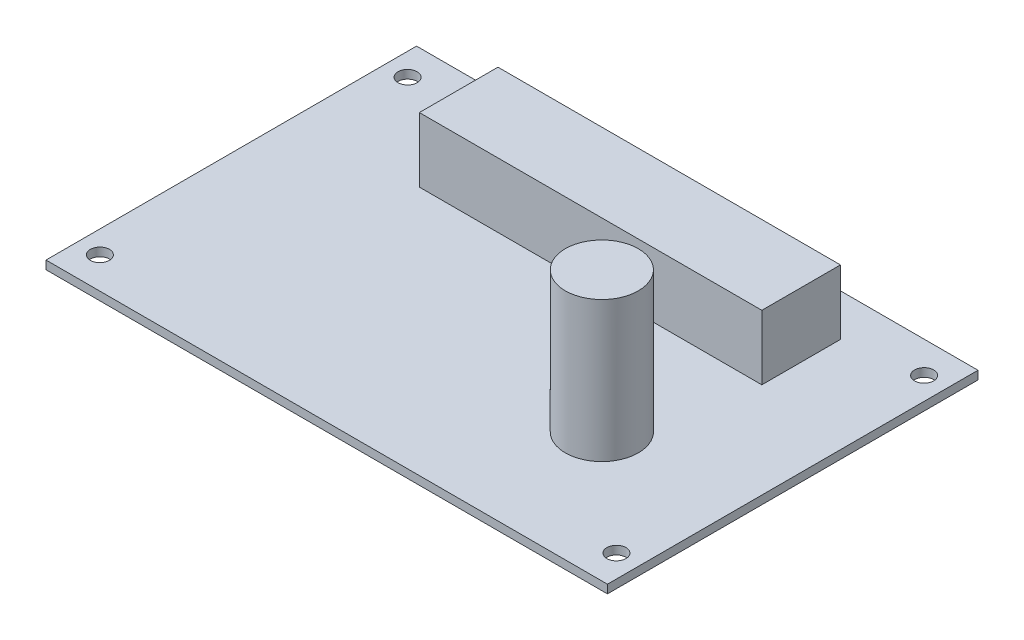
from build123d import *

# Parameters (mm, degrees)
SKIZZE1_W                       = 100
SKIZZE1_H                       = 66
AUFSATZ_LINEAR_AUSTRAGEN1_DEPTH = 1.5
SKIZZE2_W                       = 61
SKIZZE2_H                       = 14
AUFSATZ_LINEAR_AUSTRAGEN2_DEPTH = 11.5
SKIZZE3_R                       = 6.5
AUFSATZ_LINEAR_AUSTRAGEN3_DEPTH = 25
DURCHGANGSLOCH_F_R_M31_D        = 3.4


with BuildPart() as part:
    # Skizze1 → Aufsatz-Linear austragen1 (new body)
    with BuildSketch(Plane(origin=(0, 0, 0), x_dir=(1, 0, 0), z_dir=(0, 1, 0))):
        Rectangle(SKIZZE1_W, SKIZZE1_H)
    extrude(amount=AUFSATZ_LINEAR_AUSTRAGEN1_DEPTH)

    # Skizze2 → Aufsatz-Linear austragen2 (add)
    with BuildSketch(Plane(origin=(0, 1.5, 0), x_dir=(1, 0, 0), z_dir=(0, 1, 0))):
        with Locations((2.5, 18.5)):
            Rectangle(SKIZZE2_W, SKIZZE2_H)
    extrude(amount=AUFSATZ_LINEAR_AUSTRAGEN2_DEPTH)

    # Skizze3 → Aufsatz-Linear austragen3 (add)
    with BuildSketch(Plane(origin=(0, 1.5, 0), x_dir=(1, 0, 0), z_dir=(0, 1, 0))):
        with Locations((26, -10)):
            Circle(SKIZZE3_R)
    extrude(amount=AUFSATZ_LINEAR_AUSTRAGEN3_DEPTH)

    # Durchgangsloch für M31 (through all)
    with Locations(Plane(origin=(0, 1.5, 0), x_dir=(1, 0, 0), z_dir=(0, 1, 0))):
        with Locations((-46, -27.400776428), (-46, 27.400776428), (46, 27.400776428), (46, -27.400776428)):
            Hole(DURCHGANGSLOCH_F_R_M31_D / 2)


solid = part.part
